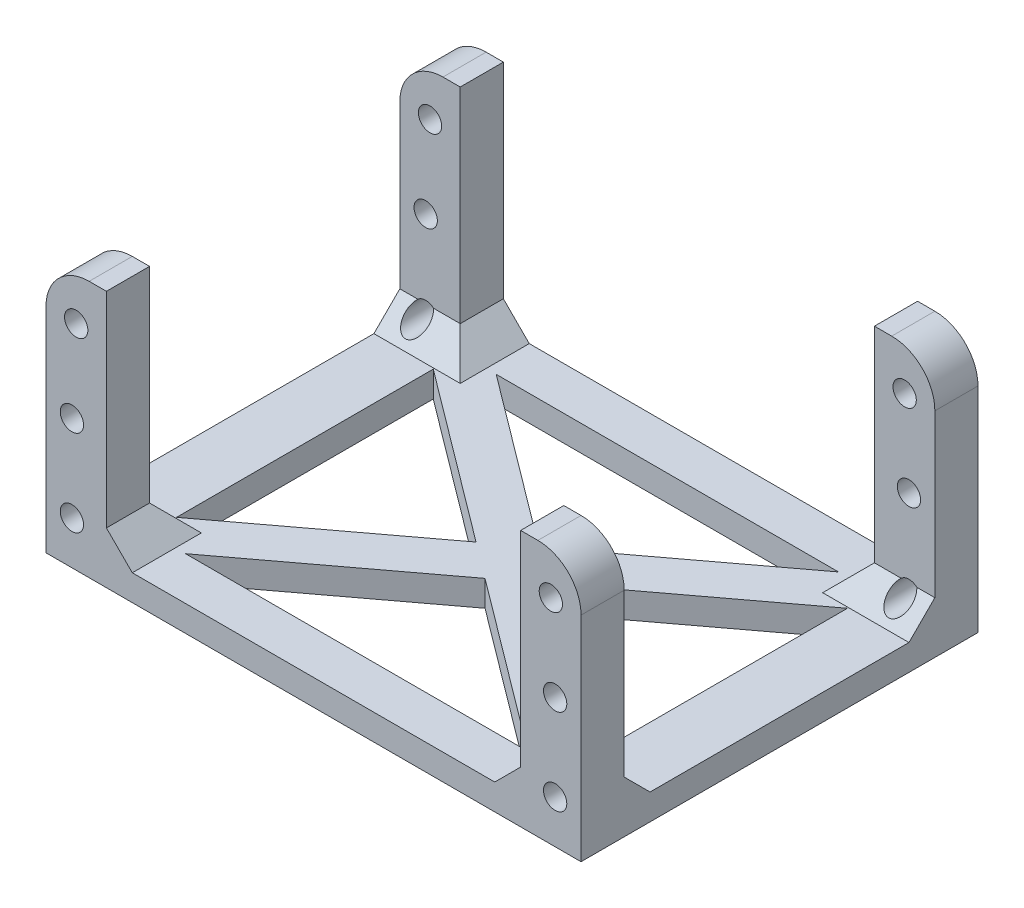
from build123d import *

# Parameters (mm, degrees)
SKETCH_1_W          = 62
SKETCH_1_H          = 46
EXTRUDE_1_DEPTH     = 3
SKETCH_2_W          = 7
SKETCH_2_H          = 17
EXTRUDE_2_DEPTH     = 5
SKETCH_3_R          = 1.35
CUT_EXTRUDE_1_DEPTH = 12
SKETCH_7_W          = 7
SKETCH_7_H          = 5
EXTRUDE_4_DEPTH     = 9.75
CUT_EXTRUDE_4_REACH = 64.945
SKETCH_8_R          = 1.35
CUT_EXTRUDE_3_REACH = 50.735
SKETCH_5_W          = 48
SKETCH_5_H          = 36
EXTRUDE_3_DEPTH     = 3
CHAMFER_4_SIZE      = 3
FILLET_1_R          = 5


with BuildPart() as part:
    # 草图1 → 凸台-拉伸1 (new body)
    with BuildSketch(Plane(origin=(0, 0, 0), x_dir=(1, 0, 0), z_dir=(0, 1, 0))):
        Rectangle(SKETCH_1_W, SKETCH_1_H)
    extrude(amount=EXTRUDE_1_DEPTH)

    # 草图2 → 凸台-拉伸2 (add)
    with BuildSketch(Plane.XY.offset(23)):
        with Locations((-27.5, 11.5)):
            Rectangle(SKETCH_2_W, SKETCH_2_H)
        with Locations((27.5, 11.5)):
            Rectangle(SKETCH_2_W, SKETCH_2_H)
    extrude_2 = extrude(amount=-EXTRUDE_2_DEPTH)

    # 草图3 → 切除-拉伸1 (cut)
    with BuildSketch(Plane.XY.offset(23)):
        with Locations((-28, 15)):
            Circle(SKETCH_3_R)
        with Locations((-28, 5)):
            Circle(SKETCH_3_R)
        with Locations((28, 5)):
            Circle(SKETCH_3_R)
        with Locations((28, 15)):
            Circle(SKETCH_3_R)
    cut_extrude_1 = extrude(amount=-CUT_EXTRUDE_1_DEPTH, mode=Mode.SUBTRACT)

    # 草图7 → 凸台-拉伸4 (add)
    with BuildSketch(Plane(origin=(0, 20, 0), x_dir=(1, 0, 0), z_dir=(0, 1, 0))):
        with Locations((-27.5, -20.5)):
            Rectangle(SKETCH_7_W, SKETCH_7_H)
        with Locations((27.5, -20.5)):
            Rectangle(SKETCH_7_W, SKETCH_7_H)
    extrude_4 = extrude(amount=EXTRUDE_4_DEPTH)

    # 草图8 → 切除-拉伸4 (cut, up to next)
    with BuildSketch(Plane.XY.offset(23), mode=Mode.PRIVATE) as cut_extrude_4_sk1:
        with Locations((-27.5, 24.75)):
            Circle(SKETCH_8_R)
    cut_extrude_4_tool1 = extrude(cut_extrude_4_sk1.sketch, amount=-CUT_EXTRUDE_4_REACH, mode=Mode.PRIVATE) & part.part
    # 草图8 → 切除-拉伸4 (cut, up to next)
    with BuildSketch(Plane.XY.offset(23), mode=Mode.PRIVATE) as cut_extrude_4_sk2:
        with Locations((27.5, 24.75)):
            Circle(SKETCH_8_R)
    cut_extrude_4_tool2 = extrude(cut_extrude_4_sk2.sketch, amount=-CUT_EXTRUDE_4_REACH, mode=Mode.PRIVATE) & part.part
    cut_extrude_4_1 = cut_extrude_4_tool1.solids().sort_by_distance((-27.5, 24.75, 23))[0]
    add(cut_extrude_4_1, mode=Mode.SUBTRACT)
    cut_extrude_4_2 = cut_extrude_4_tool2.solids().sort_by_distance((27.5, 24.75, 23))[0]
    add(cut_extrude_4_2, mode=Mode.SUBTRACT)
    cut_extrude_4 = cut_extrude_4_1 + cut_extrude_4_2  # 切除-拉伸4 as one shape, for the pattern or mirror that repeats it

    # 镜向1: 凸台-拉伸2, 切除-拉伸1, 凸台-拉伸4, 切除-拉伸4 across plane
    add(extrude_2.mirror(Plane.XY))
    add(cut_extrude_1.mirror(Plane.XY), mode=Mode.SUBTRACT)
    add(extrude_4.mirror(Plane.XY))
    add(cut_extrude_4.mirror(Plane.XY), mode=Mode.SUBTRACT)

    # 草图5 → 切除-拉伸3 (cut, up to next)
    with BuildSketch(Plane(origin=(0, 29.75, 0), x_dir=(1, 0, 0), z_dir=(0, 1, 0)), mode=Mode.PRIVATE) as cut_extrude_3_sk1:
        Rectangle(SKETCH_5_W, SKETCH_5_H)
    cut_extrude_3_tool1 = extrude(cut_extrude_3_sk1.sketch, amount=-CUT_EXTRUDE_3_REACH, mode=Mode.PRIVATE) & part.part
    add(cut_extrude_3_tool1.solids().sort_by_distance((0, 29.75, 0))[0], mode=Mode.SUBTRACT)

    # 草图6 → 凸台-拉伸3 (add)
    with BuildSketch(Plane(origin=(0, 0, 0), x_dir=(1, 0, 0), z_dir=(0, 1, 0))):
        Polygon((-25.5, 16), (-4.166666667, 0), (0, 3.125), (-22.5, 20), align=None)
        Polygon((0, 3.125), (4.166666667, 0), (25.5, 16), (22.5, 20), align=None)
        Polygon((-4.166666667, 0), (0, -3.125), (4.166666667, 0), (0, 3.125), align=None)
        Polygon((-22.5, -20), (0, -3.125), (-4.166666667, 0), (-25.5, -16), align=None)
        Polygon((0, -3.125), (22.5, -20), (25.5, -16), (4.166666667, 0), align=None)
    extrude(amount=EXTRUDE_3_DEPTH)

    # 倒角4
    # the kernel refuses this chamfer: 3 mm, written as the material it adds along each edge
    with BuildSketch(Plane(origin=(24, 3, -23), x_dir=(-0.9996219169112968, -0.027495876610586046, 0), z_dir=(0, 0, 1))) as chamfer_4_piece_1:
        Polygon((CHAMFER_4_SIZE * 0.999621916911, -CHAMFER_4_SIZE * 0.0274958766106), (-CHAMFER_4_SIZE * 0.0274958766106, -CHAMFER_4_SIZE * 0.999621916911), (0, 0), align=None)
    extrude(amount=5)
    with BuildSketch(Plane(origin=(31, 3, -18), x_dir=(0, -0.02749587661058635, 0.9996219169112968), z_dir=(-1, 0, 0))) as chamfer_4_piece_2_section:
        Polygon((CHAMFER_4_SIZE * 0.999621916911, CHAMFER_4_SIZE * 0.0274958766106), (-CHAMFER_4_SIZE * 0.0274958766106, CHAMFER_4_SIZE * 0.999621916911), (0, 0), align=None)
    chamfer_4_piece_2 = extrude(amount=7, mode=Mode.PRIVATE)
    chamfer_4_piece_2 = chamfer_4_piece_2 - Plane(origin=(28, 5, -15.465016305), x_dir=(1, 0, 0), z_dir=(0, 0, -1)) * Cylinder(1.35, 26, mode=Mode.PRIVATE)
    add(chamfer_4_piece_2)
    with BuildSketch(Plane(origin=(-31, 3, 18), x_dir=(0, -0.02749587661058635, -0.9996219169112968), z_dir=(1, 0, 0))) as chamfer_4_piece_3_section:
        Polygon((CHAMFER_4_SIZE * 0.999621916911, CHAMFER_4_SIZE * 0.0274958766106), (-CHAMFER_4_SIZE * 0.0274958766106, CHAMFER_4_SIZE * 0.999621916911), (0, 0), align=None)
    chamfer_4_piece_3 = extrude(amount=7, mode=Mode.PRIVATE)
    chamfer_4_piece_3 = chamfer_4_piece_3 - Plane(origin=(-28, 5, 15.465016305), x_dir=(1, 0, 0), z_dir=(0, 0, 1)) * Cylinder(1.35, 26, mode=Mode.PRIVATE)
    add(chamfer_4_piece_3)
    with BuildSketch(Plane(origin=(-24, 3, 23), x_dir=(-0.027495876610586775, 0.9996219169112968, 0), z_dir=(0, 0, -1)), Plane(origin=(24, 3, 23), x_dir=(-0.9996219169112968, -0.027495876610586046, 0), z_dir=(0, 0, -1)), Plane(origin=(-24, 3, -23), x_dir=(0.9996219169112968, -0.027495876610586334, 0), z_dir=(0, 0, 1))) as chamfer_4_piece_4:
        Polygon((CHAMFER_4_SIZE * 0.999621916911, CHAMFER_4_SIZE * 0.0274958766106), (-CHAMFER_4_SIZE * 0.0274958766106, CHAMFER_4_SIZE * 0.999621916911), (0, 0), align=None)
    extrude(amount=5)
    with BuildSketch(Plane(origin=(31, 3, 18), x_dir=(0, -0.02749587661058635, -0.9996219169112968), z_dir=(-1, 0, 0))) as chamfer_4_piece_5_section:
        Polygon((CHAMFER_4_SIZE * 0.999621916911, -CHAMFER_4_SIZE * 0.0274958766106), (-CHAMFER_4_SIZE * 0.0274958766106, -CHAMFER_4_SIZE * 0.999621916911), (0, 0), align=None)
    chamfer_4_piece_5 = extrude(amount=7, mode=Mode.PRIVATE)
    chamfer_4_piece_5 = chamfer_4_piece_5 - Plane(origin=(28, 5, 15.465016305), x_dir=(1, 0, 0), z_dir=(0, 0, 1)) * Cylinder(1.35, 26, mode=Mode.PRIVATE)
    add(chamfer_4_piece_5)
    with BuildSketch(Plane(origin=(-31, 3, -18), x_dir=(0, -0.02749587661058635, 0.9996219169112968), z_dir=(1, 0, 0))) as chamfer_4_piece_6_section:
        Polygon((CHAMFER_4_SIZE * 0.999621916911, -CHAMFER_4_SIZE * 0.0274958766106), (-CHAMFER_4_SIZE * 0.0274958766106, -CHAMFER_4_SIZE * 0.999621916911), (0, 0), align=None)
    chamfer_4_piece_6 = extrude(amount=7, mode=Mode.PRIVATE)
    chamfer_4_piece_6 = chamfer_4_piece_6 - Plane(origin=(-28, 5, -15.465016305), x_dir=(1, 0, 0), z_dir=(0, 0, -1)) * Cylinder(1.35, 26, mode=Mode.PRIVATE)
    add(chamfer_4_piece_6)
    with BuildSketch(Plane(origin=(31, 3, -18), x_dir=(0, -0.02749587661058635, 0.9996219169112968), z_dir=(-1, 0, 0))) as chamfer_4_piece_7a_section:
        Polygon((CHAMFER_4_SIZE * 0.999621916911, CHAMFER_4_SIZE * 0.0274958766106), (-CHAMFER_4_SIZE * 0.0274958766106, CHAMFER_4_SIZE * 0.999621916911), (0, 0), align=None)
    chamfer_4_piece_7a = extrude(amount=14.715048964, mode=Mode.PRIVATE)
    chamfer_4_piece_7a = split(chamfer_4_piece_7a, bisect_by=Plane(origin=(20.147093464, 3.915896715, -18.235320098), z_dir=(0.5999999999999999, 0, 0.8000000000000002)), keep=Keep.TOP, mode=Mode.PRIVATE)
    chamfer_4_piece_7a = split(chamfer_4_piece_7a, bisect_by=Plane(origin=(24, 3.915896715, -16.873190305), z_dir=(-1, 0, 0)), keep=Keep.TOP, mode=Mode.PRIVATE)
    with BuildSketch(Plane(origin=(24, 3, -23), x_dir=(-0.9996219169112968, -0.027495876610586046, 0), z_dir=(0, 0, 1))) as chamfer_4_piece_7b_section:
        Polygon((CHAMFER_4_SIZE * 0.999621916911, -CHAMFER_4_SIZE * 0.0274958766106), (-CHAMFER_4_SIZE * 0.0274958766106, -CHAMFER_4_SIZE * 0.999621916911), (0, 0), align=None)
    chamfer_4_piece_7b = extrude(amount=12.715048964, mode=Mode.PRIVATE)
    chamfer_4_piece_7b = split(chamfer_4_piece_7b, bisect_by=Plane(origin=(23.847814651, 3.930122584, -14.760860988), z_dir=(-0.6000000000000001, 0, -0.8)), keep=Keep.TOP, mode=Mode.PRIVATE)
    chamfer_4_piece_7b = split(chamfer_4_piece_7b, bisect_by=Plane(origin=(22.899773965, 3.930122584, -18), z_dir=(0, 0, 1)), keep=Keep.TOP, mode=Mode.PRIVATE)
    chamfer_4_piece_7 = chamfer_4_piece_7a & chamfer_4_piece_7b
    add(chamfer_4_piece_7)
    with BuildSketch(Plane(origin=(-24, 3, 23), x_dir=(-0.027495876610586775, 0.9996219169112968, 0), z_dir=(0, 0, -1))) as chamfer_4_piece_8a_section:
        Polygon((CHAMFER_4_SIZE * 0.999621916911, CHAMFER_4_SIZE * 0.0274958766106), (-CHAMFER_4_SIZE * 0.0274958766106, CHAMFER_4_SIZE * 0.999621916911), (0, 0), align=None)
    chamfer_4_piece_8a = extrude(amount=12.715048964, mode=Mode.PRIVATE)
    chamfer_4_piece_8a = split(chamfer_4_piece_8a, bisect_by=Plane(origin=(-22.899773965, 3.930122584, 18), z_dir=(0, 0, -1)), keep=Keep.TOP, mode=Mode.PRIVATE)
    chamfer_4_piece_8a = split(chamfer_4_piece_8a, bisect_by=Plane(origin=(-23.847814651, 3.930122584, 14.760860988), z_dir=(0.5999999999999998, 0, 0.8000000000000003)), keep=Keep.TOP, mode=Mode.PRIVATE)
    with BuildSketch(Plane(origin=(-31, 3, 18), x_dir=(0, -0.02749587661058635, -0.9996219169112968), z_dir=(1, 0, 0))) as chamfer_4_piece_8b_section:
        Polygon((CHAMFER_4_SIZE * 0.999621916911, CHAMFER_4_SIZE * 0.0274958766106), (-CHAMFER_4_SIZE * 0.0274958766106, CHAMFER_4_SIZE * 0.999621916911), (0, 0), align=None)
    chamfer_4_piece_8b = extrude(amount=14.715048964, mode=Mode.PRIVATE)
    chamfer_4_piece_8b = split(chamfer_4_piece_8b, bisect_by=Plane(origin=(-24, 3.915896715, 16.873190305), z_dir=(1, 0, 0)), keep=Keep.TOP, mode=Mode.PRIVATE)
    chamfer_4_piece_8b = split(chamfer_4_piece_8b, bisect_by=Plane(origin=(-20.147093464, 3.915896715, 18.235320098), z_dir=(-0.6000000000000001, 0, -0.8)), keep=Keep.TOP, mode=Mode.PRIVATE)
    chamfer_4_piece_8 = chamfer_4_piece_8a & chamfer_4_piece_8b
    add(chamfer_4_piece_8)
    with BuildSketch(Plane(origin=(24, 3, 23), x_dir=(-0.9996219169112968, -0.027495876610586046, 0), z_dir=(0, 0, -1))) as chamfer_4_piece_9a_section:
        Polygon((CHAMFER_4_SIZE * 0.999621916911, CHAMFER_4_SIZE * 0.0274958766106), (-CHAMFER_4_SIZE * 0.0274958766106, CHAMFER_4_SIZE * 0.999621916911), (0, 0), align=None)
    chamfer_4_piece_9a = extrude(amount=12.715048964, mode=Mode.PRIVATE)
    chamfer_4_piece_9a = split(chamfer_4_piece_9a, bisect_by=Plane(origin=(23.847814651, 3.930122584, 14.760860988), z_dir=(-0.6000000000000004, 0, 0.7999999999999997)), keep=Keep.TOP, mode=Mode.PRIVATE)
    chamfer_4_piece_9a = split(chamfer_4_piece_9a, bisect_by=Plane(origin=(22.899773965, 3.930122584, 18), z_dir=(0, 0, -1)), keep=Keep.TOP, mode=Mode.PRIVATE)
    with BuildSketch(Plane(origin=(31, 3, 18), x_dir=(0, -0.02749587661058635, -0.9996219169112968), z_dir=(-1, 0, 0))) as chamfer_4_piece_9b_section:
        Polygon((CHAMFER_4_SIZE * 0.999621916911, -CHAMFER_4_SIZE * 0.0274958766106), (-CHAMFER_4_SIZE * 0.0274958766106, -CHAMFER_4_SIZE * 0.999621916911), (0, 0), align=None)
    chamfer_4_piece_9b = extrude(amount=14.715048964, mode=Mode.PRIVATE)
    chamfer_4_piece_9b = split(chamfer_4_piece_9b, bisect_by=Plane(origin=(20.147093464, 3.915896715, 18.235320098), z_dir=(0.6000000000000003, 0, -0.7999999999999998)), keep=Keep.TOP, mode=Mode.PRIVATE)
    chamfer_4_piece_9b = split(chamfer_4_piece_9b, bisect_by=Plane(origin=(24, 3.915896715, 16.873190305), z_dir=(-1, 0, 0)), keep=Keep.TOP, mode=Mode.PRIVATE)
    chamfer_4_piece_9 = chamfer_4_piece_9a & chamfer_4_piece_9b
    add(chamfer_4_piece_9)
    with BuildSketch(Plane(origin=(-24, 3, -23), x_dir=(0.9996219169112968, -0.027495876610586334, 0), z_dir=(0, 0, 1))) as chamfer_4_piece_10a_section:
        Polygon((CHAMFER_4_SIZE * 0.999621916911, CHAMFER_4_SIZE * 0.0274958766106), (-CHAMFER_4_SIZE * 0.0274958766106, CHAMFER_4_SIZE * 0.999621916911), (0, 0), align=None)
    chamfer_4_piece_10a = extrude(amount=12.715048964, mode=Mode.PRIVATE)
    chamfer_4_piece_10a = split(chamfer_4_piece_10a, bisect_by=Plane(origin=(-23.847814651, 3.930122584, -14.760860988), z_dir=(0.6000000000000004, 0, -0.7999999999999999)), keep=Keep.TOP, mode=Mode.PRIVATE)
    chamfer_4_piece_10a = split(chamfer_4_piece_10a, bisect_by=Plane(origin=(-22.899773965, 3.930122584, -18), z_dir=(0, 0, 1)), keep=Keep.TOP, mode=Mode.PRIVATE)
    with BuildSketch(Plane(origin=(-31, 3, -18), x_dir=(0, -0.02749587661058635, 0.9996219169112968), z_dir=(1, 0, 0))) as chamfer_4_piece_10b_section:
        Polygon((CHAMFER_4_SIZE * 0.999621916911, -CHAMFER_4_SIZE * 0.0274958766106), (-CHAMFER_4_SIZE * 0.0274958766106, -CHAMFER_4_SIZE * 0.999621916911), (0, 0), align=None)
    chamfer_4_piece_10b = extrude(amount=14.715048964, mode=Mode.PRIVATE)
    chamfer_4_piece_10b = split(chamfer_4_piece_10b, bisect_by=Plane(origin=(-20.147093464, 3.915896715, -18.235320098), z_dir=(-0.6000000000000005, 0, 0.7999999999999997)), keep=Keep.TOP, mode=Mode.PRIVATE)
    chamfer_4_piece_10b = split(chamfer_4_piece_10b, bisect_by=Plane(origin=(-24, 3.915896715, -16.873190305), z_dir=(1, 0, 0)), keep=Keep.TOP, mode=Mode.PRIVATE)
    chamfer_4_piece_10 = chamfer_4_piece_10a & chamfer_4_piece_10b
    add(chamfer_4_piece_10)

    # 圆角1
    fillet_1_edges = [part.edges().sort_by_distance(p)[0] for p in [
        (-31, 29.75, -20.5),
        (31, 29.75, -20.5),
        (-31, 29.75, 20.5),
        (31, 29.75, 20.5),
    ]]
    fillet(fillet_1_edges, radius=FILLET_1_R)


solid = part.part
